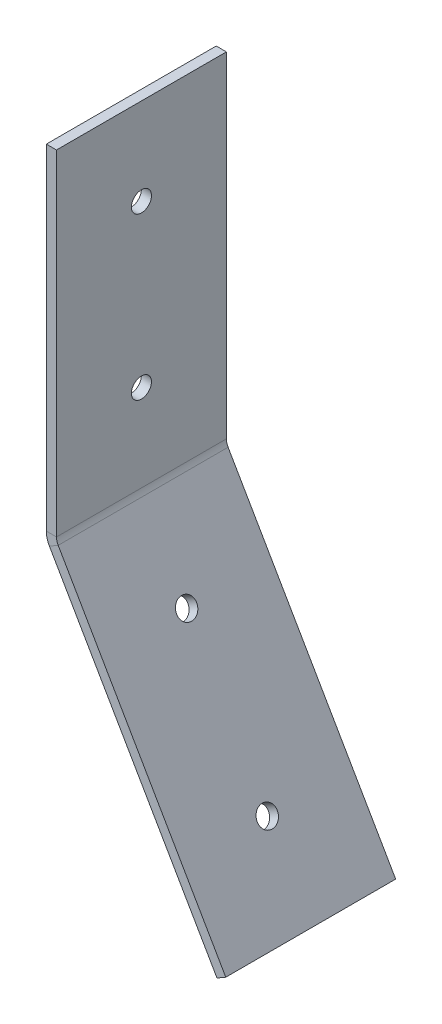
from build123d import *

# Parameters (mm, degrees)
SKETCH1_W                = 101.6
SKETCH1_H                = 25.4
BASE_FLANGE1_DEPTH       = 1.51892
SKETCHED_START           = -12.7
SKETCHED_BEND1_DEPTH     = 25.4
SKETCHED_BEND1_2_DEPTH   = 25.4
F_3_0_3_DIAMETER_HOLE1_D = 3
F_3_0_3_DIAMETER_HOLE2_D = 3


# Read off the part's stored shape, not the designer's step: Sketched Bend1
# Sheet-metal steps are written as plain solids
with BuildPart() as part:
    # Sketch1 → Base-Flange1 (new body)
    with BuildSketch(Plane.YZ):
        Rectangle(SKETCH1_W, SKETCH1_H)
    extrude(amount=-BASE_FLANGE1_DEPTH)

    # Sketched Bend1 outline → Sketched Bend1 (cut)
    with BuildSketch(Plane.XY.offset(SKETCHED_START)):
        with BuildLine():
            Line((0, -2.850729215), (-1.060201701, -1.014406003))
            ThreePointArc((-1.060201701, -1.014406003), (-1.402252755, -0.188621708), (-1.51892, 0.697553997))
            Line((-1.51892, 0.697553997), (-1.51892, -50.8))
            Line((-1.51892, -50.8), (0, -50.8))
            Line((0, -50.8), (0, -2.850729215))
        make_face()
    extrude(amount=SKETCHED_BEND1_DEPTH, mode=Mode.SUBTRACT)

    # Sketched Bend1 2 outline → Sketched Bend1 2 (add)
    with BuildSketch(Plane.XY.offset(SKETCHED_START)):
        with BuildLine():
            Line((0, 0.697553997), (0, -2.850729215))
            Line((0, -2.850729215), (23.991021301, -44.404397034))
            Line((23.991021301, -44.404397034), (25.306444607, -43.644937034))
            Line((25.306444607, -43.644937034), (0.255221606, -0.254946003))
            ThreePointArc((0.255221606, -0.254946003), (0.064911301, 0.204503716), (0, 0.697553997))
        make_face()
    extrude(amount=SKETCHED_BEND1_2_DEPTH)

    # Ø3.0 (3) Diameter Hole1 (through all)
    with Locations(Plane(origin=(0.081021347, 0.046777696, 0), x_dir=(-0.500000000000001, 0.866025403784438, 0), z_dir=(0.866025403784438, 0.500000000000001, 0))):
        with Locations((-37.450846521, 0), (-13.348400518, 0)):
            Hole(F_3_0_3_DIAMETER_HOLE1_D / 2)

    # Ø3.0 (3) Diameter Hole2 (through all)
    with Locations(Plane.YZ):
        with Locations((13.697553997, 0), (37.8, 0)):
            Hole(F_3_0_3_DIAMETER_HOLE2_D / 2)


solid = part.part
